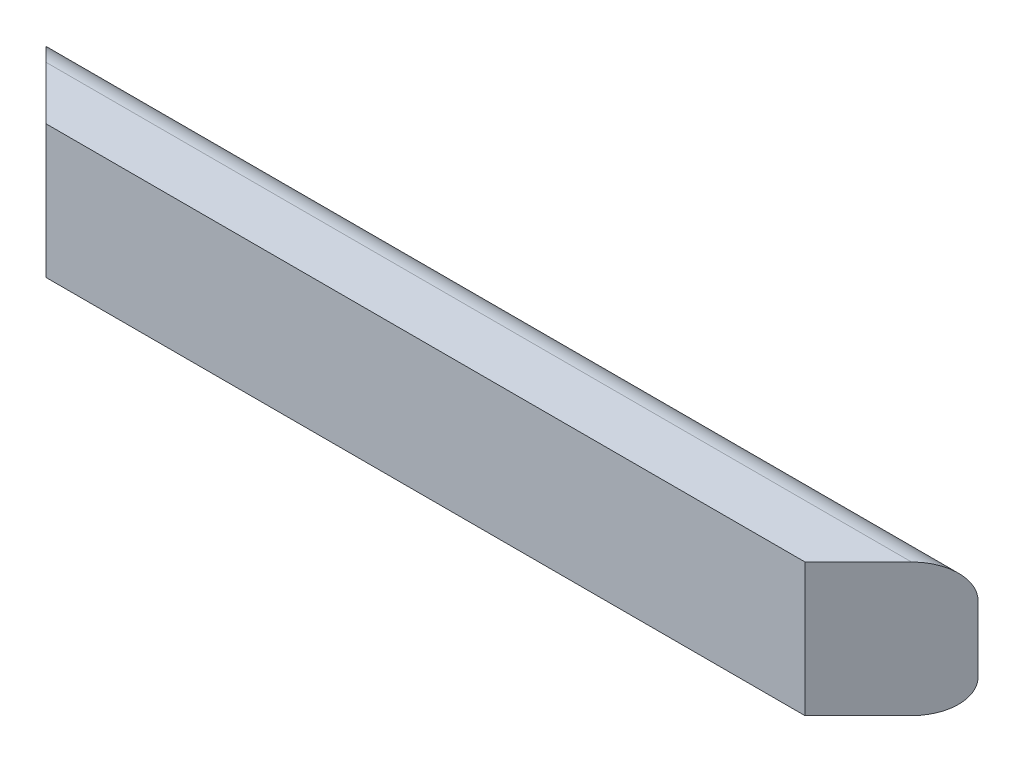
from build123d import *

# Parameters (mm, degrees)
BOSS_EXTRUDE1_DEPTH = 889
SKETCH2_W           = 344.402501539
SKETCH2_H           = 780.457540958
CUT_EXTRUDE1_DEPTH  = 686.388302351


with BuildPart() as part:
    # Sketch1 → Boss-Extrude1 (new body)
    with BuildSketch(Plane(origin=(0, 0, 0), x_dir=(0, 0, -1), z_dir=(1, 0, 0))):
        with BuildLine():
            Line((0, 0), (31.75, 0))
            ThreePointArc((31.75, 0), (54.200640303, 9.299359697), (63.5, 31.75))
            Line((63.5, 31.75), (63.5, 95.25))
            ThreePointArc((63.5, 95.25), (54.200640303, 117.700640303), (31.75, 127))
            Line((31.75, 127), (0, 127))
            Line((0, 127), (-19.05, 127))
            Line((-19.05, 127), (-19.05, 0))
            Line((-19.05, 0), (0, 0))
        make_face()
    extrude(amount=BOSS_EXTRUDE1_DEPTH)

    # Sketch2 → Cut-Extrude1 (cut, through all)
    with BuildSketch(Plane(origin=(412.75, 0, 412.75), x_dir=(0, 1, 0), z_dir=(0.7071067811865464, 0, 0.7071067811865488))):
        with Locations((32.995160032, -673.51920908)):
            Rectangle(SKETCH2_W, SKETCH2_H)
    cut_extrude1 = extrude(amount=CUT_EXTRUDE1_DEPTH, mode=Mode.SUBTRACT)

    # Mirror1: Cut-Extrude1 across plane
    add(cut_extrude1.mirror(Plane(origin=(444.5, 0, 0), x_dir=(0, 0, 1), z_dir=(1, 0, 0))), mode=Mode.SUBTRACT)


solid = part.part
